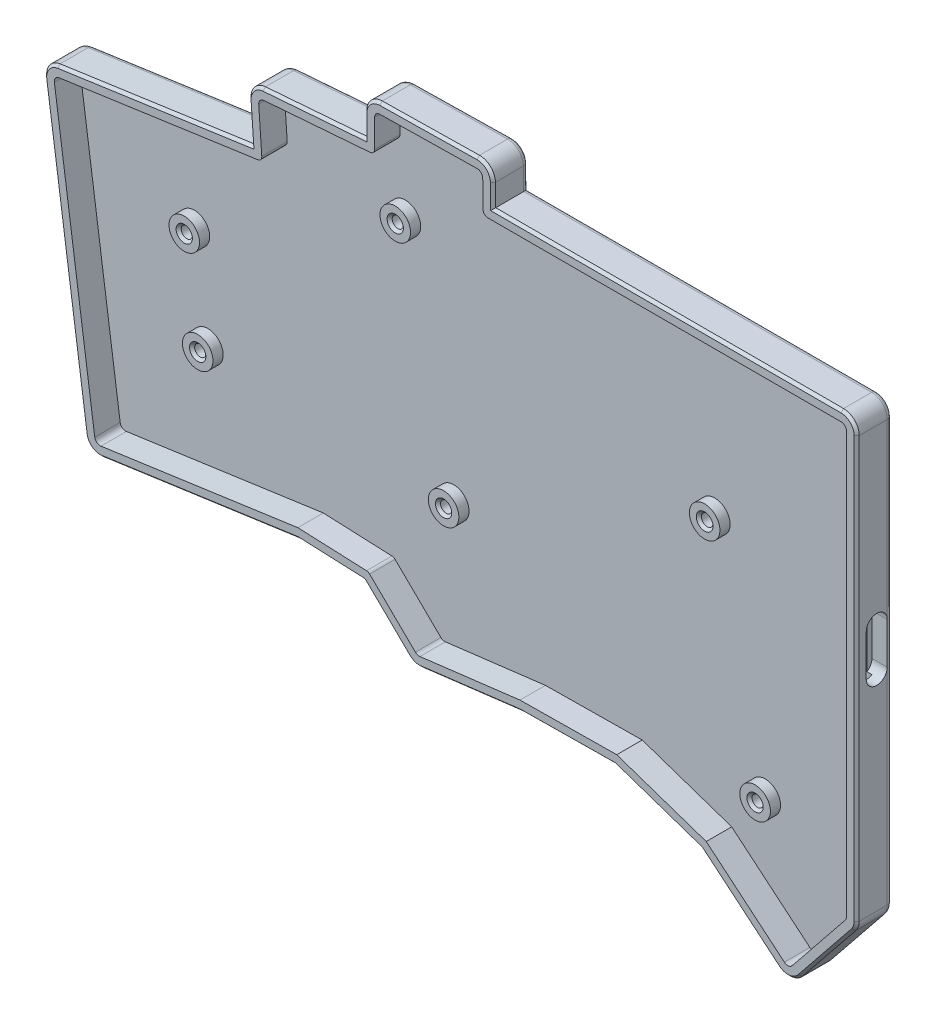
from build123d import *

# Parameters (mm, degrees)
BOSS_EXTRUDE1_DEPTH = 2
BOSS_EXTRUDE2_DEPTH = 7
SKETCH7_R           = 3
SKETCH7_R_2         = 1.100094
SKETCH7_R_3         = 1.100095
SKETCH7_R_4         = 1.14540164
SKETCH7_R_5         = 1.100094267
BOSS_EXTRUDE3_DEPTH = 4
CUT_EXTRUDE1_DEPTH  = 3
FILLET2_R           = 1
CHAMFER1_SIZE       = 0.5
CHAMFER2_SIZE       = 0.5


with BuildPart() as part:
    # Sketch3 → Boss-Extrude1 (new body)
    with BuildSketch(Plane.XY):
        with BuildLine():
            Line((60.855233133, 23.823211938), (47.949977192, 24.377676222))
            Line((47.949977192, 24.377676222), (9.438001399, 18.932389733))
            ThreePointArc((9.438001399, 18.932389733), (7.157815869, 19.520564151), (5.962231275, 21.549300871))
            Line((5.962231275, 21.549300871), (-1.970708405, 77.995680607))
            ThreePointArc((-1.970708405, 77.995680607), (-1.383464331, 80.271537635), (0.639738461, 81.467794829))
            Line((0.639738461, 81.467794829), (38.699898469, 86.902208152))
            Line((38.699898469, 86.902208152), (38.171393284, 94.460167157))
            ThreePointArc((38.171393284, 94.460167157), (38.910984807, 96.683773594), (41.002517903, 97.740613468))
            Line((41.002517903, 97.740613468), (60.921819416, 99.276682226))
            Line((60.921819416, 99.276682226), (60.921819416, 103.721902307))
            ThreePointArc((60.921819416, 103.721902307), (61.804499235, 105.878127499), (63.945786912, 106.796450874))
            Line((63.945786912, 106.796450874), (83.059551455, 107.113531682))
            ThreePointArc((83.059551455, 107.113531682), (85.251859467, 106.245869167), (86.185286941, 104.080744272))
            Line((86.185286941, 104.080744272), (86.24375422, 99.780452187))
            Line((86.24375422, 99.780452187), (154.596820419, 99.780452187))
            ThreePointArc((154.596820419, 99.780452187), (156.771169517, 98.879807301), (157.671814403, 96.705458202))
            Line((157.671814403, 96.705458202), (157.671814403, 14.057773112))
            ThreePointArc((157.671814403, 14.057773112), (157.497078938, 13.035997261), (156.992732263, 12.130352296))
            Line((156.992732263, 12.130352296), (146.547659954, -0.852593653))
            ThreePointArc((146.547659954, -0.852593653), (144.453525054, -1.98521487), (142.178510717, -1.283401812))
            Line((142.178510717, -1.283401812), (127.110775499, 11.324099062))
            Line((127.110775499, 11.324099062), (110.204782414, 17.079131321))
            Line((110.204782414, 17.079131321), (91.635796855, 16.870620568))
            Line((91.635796855, 16.870620568), (72.085555936, 14.46343429))
            ThreePointArc((72.085555936, 14.46343429), (70.725838171, 14.602041008), (69.560483965, 15.316179508))
            Line((69.560483965, 15.316179508), (60.855233133, 23.823211938))
        make_face()
    extrude(amount=BOSS_EXTRUDE1_DEPTH)

    # Sketch4 → Boss-Extrude2 (add)
    with BuildSketch(Plane.XY):
        with BuildLine():
            Line((47.949977192, 24.377676222), (60.855233133, 23.823211938))
            Line((60.855233133, 23.823211938), (69.560483965, 15.316179508))
            ThreePointArc((69.560483965, 15.316179508), (70.725838171, 14.602041008), (72.085555936, 14.46343429))
            Line((72.085555936, 14.46343429), (91.635796855, 16.870620568))
            Line((91.635796855, 16.870620568), (110.204782414, 17.079131321))
            Line((110.204782414, 17.079131321), (127.110775499, 11.324099062))
            Line((127.110775499, 11.324099062), (142.178510717, -1.283401812))
            ThreePointArc((142.178510717, -1.283401812), (144.453525054, -1.98521487), (146.547659954, -0.852593653))
            Line((146.547659954, -0.852593653), (156.992732263, 12.130352296))
            ThreePointArc((156.992732263, 12.130352296), (157.497078938, 13.035997261), (157.671814403, 14.057773112))
            Line((157.671814403, 14.057773112), (157.671814403, 96.705458202))
            ThreePointArc((157.671814403, 96.705458202), (156.771169517, 98.879807301), (154.596820419, 99.780452187))
            Line((154.596820419, 99.780452187), (86.24375422, 99.780452187))
            Line((86.24375422, 99.780452187), (86.185286941, 104.080744272))
            ThreePointArc((86.185286941, 104.080744272), (85.251859467, 106.245869167), (83.059551455, 107.113531682))
            Line((83.059551455, 107.113531682), (63.945786912, 106.796450874))
            ThreePointArc((63.945786912, 106.796450874), (61.804499235, 105.878127499), (60.921819416, 103.721902307))
            Line((60.921819416, 103.721902307), (60.921819416, 99.276682226))
            Line((60.921819416, 99.276682226), (41.002517903, 97.740613468))
            ThreePointArc((41.002517903, 97.740613468), (38.910984807, 96.683773594), (38.171393284, 94.460167157))
            Line((38.171393284, 94.460167157), (38.699898469, 86.902208152))
            Line((38.699898469, 86.902208152), (0.639738461, 81.467794829))
            ThreePointArc((0.639738461, 81.467794829), (-1.383464331, 80.271537635), (-1.970708405, 77.995680607))
            Line((-1.970708405, 77.995680607), (5.962231275, 21.549300871))
            ThreePointArc((5.962231275, 21.549300871), (7.157815869, 19.520564151), (9.438001399, 18.932389733))
            Line((9.438001399, 18.932389733), (47.949977192, 24.377676222))
        make_face()
        with BuildLine():
            ThreePointArc((84.258355662, 98.692914663), (84.533669024, 98.04695842), (85.183308419, 97.780452187))
            Line((85.183308419, 97.780452187), (154.596820419, 97.780452187))
            ThreePointArc((154.596820419, 97.780452187), (155.356955955, 97.465593738), (155.671814403, 96.705458202))
            Line((155.671814403, 96.705458202), (155.671814403, 14.057773112))
            ThreePointArc((155.671814403, 14.057773112), (155.610734868, 13.70060696), (155.434438315, 13.38403486))
            Line((155.434438315, 13.38403486), (144.989366006, 0.401088911))
            ThreePointArc((144.989366006, 0.401088911), (144.257272174, 0.005133041), (143.461944249, 0.250481615))
            Line((143.461944249, 0.250481615), (128.108249423, 13.097251096))
            Line((128.108249423, 13.097251096), (110.524936275, 19.082852408))
            Line((110.524936275, 19.082852408), (91.501949272, 18.869243682))
            Line((91.501949272, 18.869243682), (71.841145237, 16.448443965))
            ThreePointArc((71.841145237, 16.448443965), (71.365754809, 16.496904248), (70.958318613, 16.74658445))
            Line((70.958318613, 16.74658445), (61.958856362, 25.54112911))
            ThreePointArc((61.958856362, 25.54112911), (61.679828995, 25.728441638), (61.352295386, 25.803701118))
            Line((61.352295386, 25.803701118), (47.852081394, 26.383727313))
            Line((47.852081394, 26.383727313), (9.158002316, 20.91269287))
            ThreePointArc((9.158002316, 20.91269287), (8.360780393, 21.118336461), (7.942767807, 21.827644264))
            Line((7.942767807, 21.827644264), (0.009828128, 78.274024))
            ThreePointArc((0.009828128, 78.274024), (0.215128769, 79.069664055), (0.922440855, 79.487875801))
            Line((0.922440855, 79.487875801), (39.972806225, 85.063675424))
            ThreePointArc((39.972806225, 85.063675424), (40.561555536, 85.398058084), (40.76480024, 86.043913413))
            Line((40.76480024, 86.043913413), (40.166521363, 94.599680421))
            ThreePointArc((40.166521363, 94.599680421), (40.425084652, 95.377059525), (41.156290542, 95.746533736))
            Line((41.156290542, 95.746533736), (62.067941403, 97.359127107))
            ThreePointArc((62.067941403, 97.359127107), (62.675544492, 97.652931317), (62.921819416, 98.281303094))
            Line((62.921819416, 98.281303094), (62.921819416, 103.721902307))
            ThreePointArc((62.921819416, 103.721902307), (63.230393236, 104.475691655), (63.978960617, 104.796726017))
            Line((63.978960617, 104.796726017), (83.09272516, 105.113806824))
            ThreePointArc((83.09272516, 105.113806824), (83.859148665, 104.810474928), (84.185471769, 104.053554549))
            Line((84.185471769, 104.053554549), (84.258355662, 98.692914663))
        make_face(mode=Mode.SUBTRACT)
    extrude(amount=BOSS_EXTRUDE2_DEPTH)

    # Sketch7 → Boss-Extrude3 (add)
    # profile 1 of 6: a face of its own
    with BuildSketch(Plane.XY):
        with Locations((25.178343626, 43.435558637)):
            Circle(SKETCH7_R)
        with Locations((25.178343626, 43.435558637)):
            Circle(SKETCH7_R_2, mode=Mode.SUBTRACT)
    # profile 2 of 6: a face of its own
    with BuildSketch(Plane.XY):
        with Locations((22.534055897, 62.250653675)):
            Circle(SKETCH7_R)
        with Locations((22.534055897, 62.250653675)):
            Circle(SKETCH7_R_2, mode=Mode.SUBTRACT)
    # profile 3 of 6: a face of its own
    with BuildSketch(Plane.XY):
        with Locations((63.99681822, 84.705447078)):
            Circle(SKETCH7_R)
        with Locations((63.99681822, 84.705447078)):
            Circle(SKETCH7_R_3, mode=Mode.SUBTRACT)
    # profile 4 of 6: a face of its own
    with BuildSketch(Plane.XY):
        with Locations((73.496822591, 41.005447941)):
            Circle(SKETCH7_R)
        with Locations((73.496822591, 41.005447941)):
            Circle(SKETCH7_R_3, mode=Mode.SUBTRACT)
    # profile 5 of 6: a face of its own
    with BuildSketch(Plane.XY):
        with Locations((124.796820928, 64.405450202)):
            Circle(SKETCH7_R)
        with Locations((124.796820928, 64.405450202)):
            Circle(SKETCH7_R_4, mode=Mode.SUBTRACT)
    # profile 6 of 6: a face of its own
    with BuildSketch(Plane.XY):
        with Locations((134.70931431, 21.546419059)):
            Circle(SKETCH7_R)
        with Locations((134.70931431, 21.546419059)):
            Circle(SKETCH7_R_5, mode=Mode.SUBTRACT)
    extrude(amount=BOSS_EXTRUDE3_DEPTH)

    # Sketch8 → Cut-Extrude1 (cut)
    with BuildSketch(Plane(origin=(157.671814403, 0, 0), x_dir=(0, 0, -1), z_dir=(1, 0, 0))):
        with BuildLine():
            Line((-1, 62.669458202), (-1, 54.541458202))
            ThreePointArc((-1, 54.541458202), (-3.061576359, 52.479881843), (-5.123152718, 54.541458202))
            Line((-5.123152718, 54.541458202), (-5.123152718, 62.669458202))
            ThreePointArc((-5.123152718, 62.669458202), (-3.061576359, 64.731034561), (-1, 62.669458202))
        make_face()
    extrude(amount=-CUT_EXTRUDE1_DEPTH, mode=Mode.SUBTRACT)

    # Fillet2
    fillet2_edges = [part.edges().sort_by_distance(p)[0] for p in [
        (65.207858549, 19.569695723, 0),
        (54.402605163, 24.10044408, 0),
        (28.693989296, 21.655032978, 0),
        (7.157815869, 19.520564151, 0),
        (1.995761435, 49.772490739, 0),
        (-1.383464331, 80.271537635, 0),
        (19.669818465, 84.18500149, 0),
        (38.435645877, 90.681187654, 0),
        (38.910984807, 96.683773594, 0),
        (50.962168659, 98.508647847, 0),
        (60.921819416, 101.499292266, 0),
        (61.804499235, 105.878127499, 0),
        (73.502669184, 106.954991278, 0),
        (85.251859467, 106.245869167, 0),
        (86.21452058, 101.930598229, 0),
        (120.420287319, 99.780452187, 0),
        (156.771169517, 98.879807301, 0),
        (157.671814403, 55.381615657, 0),
        (157.497078938, 13.035997261, 0),
        (151.770196108, 5.638879321, 0),
        (144.453525054, -1.98521487, 0),
        (134.644643108, 5.020348625, 0),
        (118.657778957, 14.201615191, 0),
        (100.920289635, 16.974875944, 0),
        (81.860676395, 15.667027429, 0),
        (70.725838171, 14.602041008, 0),
    ]]
    fillet(fillet2_edges, radius=FILLET2_R - 0.0001)  # a hair under: the kernel refuses the full size

    # Chamfer1
    chamfer1_edges = [part.edges().sort_by_distance(p)[0] for p in [
        (70.725838171, 14.602041008, 7),
        (81.860676395, 15.667027429, 7),
        (100.920289635, 16.974875944, 7),
        (118.657778957, 14.201615191, 7),
        (134.644643108, 5.020348625, 7),
        (144.453525054, -1.98521487, 7),
        (151.770196108, 5.638879321, 7),
        (157.497078938, 13.035997261, 7),
        (157.671814403, 55.381615657, 7),
        (156.771169517, 98.879807301, 7),
        (120.420287319, 99.780452187, 7),
        (86.21452058, 101.930598229, 7),
        (85.251859467, 106.245869167, 7),
        (73.502669184, 106.954991278, 7),
        (61.804499235, 105.878127499, 7),
        (60.921819416, 101.499292266, 7),
        (50.962168659, 98.508647847, 7),
        (38.910984807, 96.683773594, 7),
        (38.435645877, 90.681187654, 7),
        (19.669818465, 84.18500149, 7),
        (-1.383464331, 80.271537635, 7),
        (1.995761435, 49.772490739, 7),
        (7.157815869, 19.520564151, 7),
        (28.693989296, 21.655032978, 7),
        (54.402605163, 24.10044408, 7),
        (65.207858549, 19.569695723, 7),
    ]]
    chamfer(chamfer1_edges, length=CHAMFER1_SIZE)

    # Chamfer2
    chamfer2_edges = [part.edges().sort_by_distance(p)[0] for p in [
        (133.609220043, 21.546419059, 4),
        (123.651419288, 64.405450202, 4),
        (72.396727591, 41.005447941, 4),
        (62.89672322, 84.705447078, 4),
        (21.433961897, 62.250653675, 4),
        (24.078249626, 43.435558637, 4),
    ]]
    chamfer(chamfer2_edges, length=CHAMFER2_SIZE)


solid = part.part
